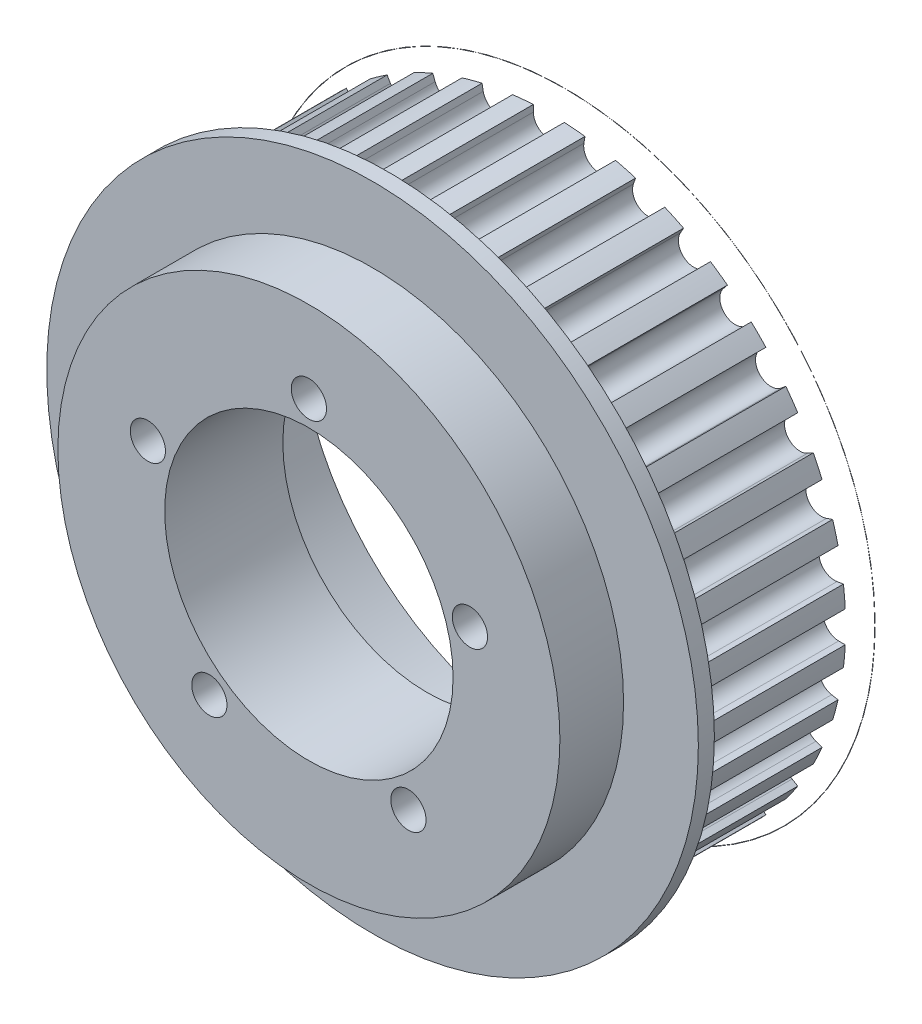
from build123d import *

# Parameters (mm, degrees)
CUT_EXTRUDE1_START         = 1.905
CUT_EXTRUDE1_DEPTH         = 16.51
CIRPATTERN1_COUNT          = 36
SKETCH4_W                  = 12.7
SKETCH4_H                  = 22.86
SKETCH4_W_2                = 2.415
SKETCH4_H_2                = 30.23
CUT_EXTRUDE2_DEPTH         = 1.51
SKETCH6_R                  = 23.5
CUT_EXTRUDE3_DEPTH         = 11.4
SKETCH7_R                  = 13.5
CUT_EXTRUDE4_DEPTH         = 3.6
SKETCH8_R                  = 23.5
SKETCH8_R_2                = 13.5
BOSS_EXTRUDE1_DEPTH        = 7.46
SKETCH10_W                 = 1.65
SKETCH10_H                 = 23.97
M4_TAPPED_HOLE1_AT_2_COUNT = 2
M4_TAPPED_HOLE1_AT_2_PITCH = 18.632792498
M4_TAPPED_HOLE1_AT_3_COUNT = 2
M4_TAPPED_HOLE1_AT_3_PITCH = 30.148491567
M4_TAPPED_HOLE1_AT_4_COUNT = 2
M4_TAPPED_HOLE1_AT_4_PITCH = 30.148491567
M4_TAPPED_HOLE1_AT_5_COUNT = 2
M4_TAPPED_HOLE1_AT_5_PITCH = 18.632792498
SKETCH11_R                 = 30.5
SKETCH11_R_2               = 23.5
BOSS_EXTRUDE3_DEPTH        = 1.5


with BuildPart() as part:
    # Sketch2 → Revolve1 (revolve)
    with BuildSketch(Plane(origin=(0, 0, 0), x_dir=(0, 0, -1), z_dir=(1, 0, 0)), mode=Mode.PRIVATE) as revolve1_sk:
        with BuildLine():
            Line((-17.02, 6.75), (17.02, 6.75))
            Line((17.02, 6.75), (17.02, 30.23))
            Line((17.02, 30.23), (15.8125, 30.23))
            ThreePointArc((15.8125, 30.23), (14.953775664, 29.87144327), (14.605, 29.0087))
            Line((14.605, 29.0087), (14.605, 27.7874))
            Line((14.605, 27.7874), (-1.905, 27.7874))
            Line((-1.905, 27.7874), (-1.905, 29.0087))
            ThreePointArc((-1.905, 29.0087), (-2.257840529, 29.867424336), (-3.1125, 30.23))
            Line((-3.1125, 30.23), (-4.32, 30.23))
            Line((-4.32, 30.23), (-4.32, 22.86))
            Line((-4.32, 22.86), (-17.02, 22.86))
            Line((-17.02, 22.86), (-17.02, 6.75))
        make_face()
    revolve(revolve1_sk.sketch.rotate(Axis((0, 0, 17.02), (0, 0, -1)), 90), axis=Axis((0, 0, 17.02), (0, 0, -1)))

    # Sketch3 → Cut-Extrude1 (cut)
    with BuildSketch(Plane.XY.offset(CUT_EXTRUDE1_START)):
        with BuildLine():
            Line((-1.447918132, 27.137202459), (-1.45442745, 27.749310614))
            ThreePointArc((-1.45442745, 27.749310614), (0, 27.7874), (1.45442745, 27.749310614))
            Line((1.45442745, 27.749310614), (1.447918132, 27.137202459))
            ThreePointArc((1.447918132, 27.137202459), (0, 25.7046), (-1.447918132, 27.137202459))
        make_face()
    cut_extrude1 = extrude(amount=-CUT_EXTRUDE1_DEPTH, mode=Mode.SUBTRACT)

    # CirPattern1: Cut-Extrude1 ×36 about axis
    cirpattern1_axis = Axis((0, 0, 0), (0, 0, 1))
    for i in range(1, CIRPATTERN1_COUNT):
        add(cut_extrude1.rotate(cirpattern1_axis, i * 360 / CIRPATTERN1_COUNT), mode=Mode.SUBTRACT)

    # Sketch4 → Cut-Revolve2 (revolve, cut)
    with BuildSketch(Plane(origin=(0, 0, 0), x_dir=(0, 0, -1), z_dir=(1, 0, 0)), mode=Mode.PRIVATE) as cut_revolve2_sk:
        with Locations((-10.67, 11.43)):
            Rectangle(SKETCH4_W, SKETCH4_H)
        Polygon((-4.32, 0), (-1.905, 0), (-1.905, 30.23), (-4.32, 30.23), (-4.32, 22.86), align=None)
        with Locations((15.8125, 15.115)):
            Rectangle(SKETCH4_W_2, SKETCH4_H_2)
    revolve(cut_revolve2_sk.sketch.rotate(Axis((0, 0, 0), (0, 0, 1)), 180), axis=Axis((0, 0, 0), (0, 0, 1)), mode=Mode.SUBTRACT)


with BuildPart() as cut_revolve2_piece_1:
    # of the separate pieces the step leaves, piece 1, a body of its own (cut_revolve2_pieces)
    add(part.part.solids().sort_by_distance((6.75, 0, 1.905))[0])

    # Sketch5 → Cut-Extrude2 (cut)
    with BuildSketch(Plane(origin=(0, 0, -14.605), x_dir=(-1, 0, 0), z_dir=(0, 0, -1))):
        with BuildLine():
            Line((26.473499032, 6.138246756), (27.075177557, 6.250948649))
            ThreePointArc((27.075177557, 6.250948649), (26.840567305, 7.191908334), (26.573265901, 8.124108451))
            Line((26.573265901, 8.124108451), (25.995846067, 7.920871891))
            ThreePointArc((25.995846067, 7.920871891), (24.15442294, 8.791490976), (25.005411733, 10.642067858))
            Line((25.005411733, 10.642067858), (25.578378931, 10.857537936))
            ThreePointArc((25.578378931, 10.857537936), (25.183937002, 11.743462686), (24.758821654, 12.615084187))
            Line((24.758821654, 12.615084187), (24.225465783, 12.314667345))
            ThreePointArc((24.225465783, 12.314667345), (22.260836594, 12.8523), (22.777547651, 14.822535114))
            Line((22.777547651, 14.822535114), (23.304394204, 15.134226427))
            ThreePointArc((23.304394204, 15.134226427), (22.762105515, 15.938197867), (22.19209314, 16.722756974))
            Line((22.19209314, 16.722756974), (21.71900698, 16.334287864))
            ThreePointArc((21.71900698, 16.334287864), (19.690865993, 16.522598392), (19.857599311, 18.552627141))
            Line((19.857599311, 18.552627141), (20.322317252, 18.951069106))
            ThreePointArc((20.322317252, 18.951069106), (19.648658972, 19.648658972), (18.951069106, 20.322317252))
            Line((18.951069106, 20.322317252), (18.552627141, 19.857599311))
            ThreePointArc((18.552627141, 19.857599311), (16.522598392, 19.690865993), (16.334287864, 21.71900698))
            Line((16.334287864, 21.71900698), (16.722756974, 22.19209314))
            ThreePointArc((16.722756974, 22.19209314), (15.938197867, 22.762105515), (15.134226427, 23.304394204))
            Line((15.134226427, 23.304394204), (14.822535114, 22.777547651))
            ThreePointArc((14.822535114, 22.777547651), (12.8523, 22.260836594), (12.314667345, 24.225465783))
            Line((12.314667345, 24.225465783), (12.615084187, 24.758821654))
            ThreePointArc((12.615084187, 24.758821654), (11.743462686, 25.183937002), (10.857537936, 25.578378931))
            Line((10.857537936, 25.578378931), (10.642067858, 25.005411733))
            ThreePointArc((10.642067858, 25.005411733), (8.791490976, 24.15442294), (7.920871891, 25.995846067))
            Line((7.920871891, 25.995846067), (8.124108451, 26.573265901))
            ThreePointArc((8.124108451, 26.573265901), (7.191908334, 26.840567305), (6.250948649, 27.075177557))
            Line((6.250948649, 27.075177557), (6.138246756, 26.473499032))
            ThreePointArc((6.138246756, 26.473499032), (4.463556948, 25.314089368), (3.286404752, 26.976355722))
            Line((3.286404752, 26.976355722), (3.386285791, 27.58029491))
            ThreePointArc((3.386285791, 27.58029491), (2.421831486, 27.681660554), (1.45442745, 27.749310614))
            Line((1.45442745, 27.749310614), (1.447918132, 27.137202459))
            ThreePointArc((1.447918132, 27.137202459), (0, 25.7046), (-1.447918132, 27.137202459))
            Line((-1.447918132, 27.137202459), (-1.45442745, 27.749310614))
            ThreePointArc((-1.45442745, 27.749310614), (-2.421831486, 27.681660554), (-3.386285791, 27.58029491))
            Line((-3.386285791, 27.58029491), (-3.286404752, 26.976355722))
            ThreePointArc((-3.286404752, 26.976355722), (-4.463556948, 25.314089368), (-6.138246756, 26.473499032))
            Line((-6.138246756, 26.473499032), (-6.250948649, 27.075177557))
            ThreePointArc((-6.250948649, 27.075177557), (-7.191908334, 26.840567305), (-8.124108451, 26.573265901))
            Line((-8.124108451, 26.573265901), (-7.920871891, 25.995846067))
            ThreePointArc((-7.920871891, 25.995846067), (-8.791490976, 24.15442294), (-10.642067858, 25.005411733))
            Line((-10.642067858, 25.005411733), (-10.857537936, 25.578378931))
            ThreePointArc((-10.857537936, 25.578378931), (-11.743462686, 25.183937002), (-12.615084187, 24.758821654))
            Line((-12.615084187, 24.758821654), (-12.314667345, 24.225465783))
            ThreePointArc((-12.314667345, 24.225465783), (-12.8523, 22.260836594), (-14.822535114, 22.777547651))
            Line((-14.822535114, 22.777547651), (-15.134226427, 23.304394204))
            ThreePointArc((-15.134226427, 23.304394204), (-15.938197867, 22.762105515), (-16.722756974, 22.19209314))
            Line((-16.722756974, 22.19209314), (-16.334287864, 21.71900698))
            ThreePointArc((-16.334287864, 21.71900698), (-16.522598392, 19.690865993), (-18.552627141, 19.857599311))
            Line((-18.552627141, 19.857599311), (-18.951069106, 20.322317252))
            ThreePointArc((-18.951069106, 20.322317252), (-19.648658972, 19.648658972), (-20.322317252, 18.951069106))
            Line((-20.322317252, 18.951069106), (-19.857599311, 18.552627141))
            ThreePointArc((-19.857599311, 18.552627141), (-19.690865993, 16.522598392), (-21.71900698, 16.334287864))
            Line((-21.71900698, 16.334287864), (-22.19209314, 16.722756974))
            ThreePointArc((-22.19209314, 16.722756974), (-22.762105515, 15.938197867), (-23.304394204, 15.134226427))
            Line((-23.304394204, 15.134226427), (-22.777547651, 14.822535114))
            ThreePointArc((-22.777547651, 14.822535114), (-22.260836594, 12.8523), (-24.225465783, 12.314667345))
            Line((-24.225465783, 12.314667345), (-24.758821654, 12.615084187))
            ThreePointArc((-24.758821654, 12.615084187), (-25.183937002, 11.743462686), (-25.578378931, 10.857537936))
            Line((-25.578378931, 10.857537936), (-25.005411733, 10.642067858))
            ThreePointArc((-25.005411733, 10.642067858), (-24.15442294, 8.791490976), (-25.995846067, 7.920871891))
            Line((-25.995846067, 7.920871891), (-26.573265901, 8.124108451))
            ThreePointArc((-26.573265901, 8.124108451), (-26.840567305, 7.191908334), (-27.075177557, 6.250948649))
            Line((-27.075177557, 6.250948649), (-26.473499032, 6.138246756))
            ThreePointArc((-26.473499032, 6.138246756), (-25.314089368, 4.463556948), (-26.976355722, 3.286404752))
            Line((-26.976355722, 3.286404752), (-27.58029491, 3.386285791))
            ThreePointArc((-27.58029491, 3.386285791), (-27.681660554, 2.421831486), (-27.749310614, 1.45442745))
            Line((-27.749310614, 1.45442745), (-27.137202459, 1.447918132))
            ThreePointArc((-27.137202459, 1.447918132), (-25.7046, 0), (-27.137202459, -1.447918132))
            Line((-27.137202459, -1.447918132), (-27.749310614, -1.45442745))
            ThreePointArc((-27.749310614, -1.45442745), (-27.681660554, -2.421831486), (-27.58029491, -3.386285791))
            Line((-27.58029491, -3.386285791), (-26.976355722, -3.286404752))
            ThreePointArc((-26.976355722, -3.286404752), (-25.314089368, -4.463556948), (-26.473499032, -6.138246756))
            Line((-26.473499032, -6.138246756), (-27.075177557, -6.250948649))
            ThreePointArc((-27.075177557, -6.250948649), (-26.840567305, -7.191908334), (-26.573265901, -8.124108451))
            Line((-26.573265901, -8.124108451), (-25.995846067, -7.920871891))
            ThreePointArc((-25.995846067, -7.920871891), (-24.15442294, -8.791490976), (-25.005411733, -10.642067858))
            Line((-25.005411733, -10.642067858), (-25.578378931, -10.857537936))
            ThreePointArc((-25.578378931, -10.857537936), (-25.183937002, -11.743462686), (-24.758821654, -12.615084187))
            Line((-24.758821654, -12.615084187), (-24.225465783, -12.314667345))
            ThreePointArc((-24.225465783, -12.314667345), (-22.260836594, -12.8523), (-22.777547651, -14.822535114))
            Line((-22.777547651, -14.822535114), (-23.304394204, -15.134226427))
            ThreePointArc((-23.304394204, -15.134226427), (-22.762105515, -15.938197867), (-22.19209314, -16.722756974))
            Line((-22.19209314, -16.722756974), (-21.71900698, -16.334287864))
            ThreePointArc((-21.71900698, -16.334287864), (-19.690865993, -16.522598392), (-19.857599311, -18.552627141))
            Line((-19.857599311, -18.552627141), (-20.322317252, -18.951069106))
            ThreePointArc((-20.322317252, -18.951069106), (-19.648658972, -19.648658972), (-18.951069106, -20.322317252))
            Line((-18.951069106, -20.322317252), (-18.552627141, -19.857599311))
            ThreePointArc((-18.552627141, -19.857599311), (-16.522598392, -19.690865993), (-16.334287864, -21.71900698))
            Line((-16.334287864, -21.71900698), (-16.722756974, -22.19209314))
            ThreePointArc((-16.722756974, -22.19209314), (-15.938197867, -22.762105515), (-15.134226427, -23.304394204))
            Line((-15.134226427, -23.304394204), (-14.822535114, -22.777547651))
            ThreePointArc((-14.822535114, -22.777547651), (-12.8523, -22.260836594), (-12.314667345, -24.225465783))
            Line((-12.314667345, -24.225465783), (-12.615084187, -24.758821654))
            ThreePointArc((-12.615084187, -24.758821654), (-11.743462686, -25.183937002), (-10.857537936, -25.578378931))
            Line((-10.857537936, -25.578378931), (-10.642067858, -25.005411733))
            ThreePointArc((-10.642067858, -25.005411733), (-8.791490976, -24.15442294), (-7.920871891, -25.995846067))
            Line((-7.920871891, -25.995846067), (-8.124108451, -26.573265901))
            ThreePointArc((-8.124108451, -26.573265901), (-7.191908334, -26.840567305), (-6.250948649, -27.075177557))
            Line((-6.250948649, -27.075177557), (-6.138246756, -26.473499032))
            ThreePointArc((-6.138246756, -26.473499032), (-4.463556948, -25.314089368), (-3.286404752, -26.976355722))
            Line((-3.286404752, -26.976355722), (-3.386285791, -27.58029491))
            ThreePointArc((-3.386285791, -27.58029491), (-2.421831486, -27.681660554), (-1.45442745, -27.749310614))
            Line((-1.45442745, -27.749310614), (-1.447918132, -27.137202459))
            ThreePointArc((-1.447918132, -27.137202459), (0, -25.7046), (1.447918132, -27.137202459))
            Line((1.447918132, -27.137202459), (1.45442745, -27.749310614))
            ThreePointArc((1.45442745, -27.749310614), (2.421831486, -27.681660554), (3.386285791, -27.58029491))
            Line((3.386285791, -27.58029491), (3.286404752, -26.976355722))
            ThreePointArc((3.286404752, -26.976355722), (4.463556948, -25.314089368), (6.138246756, -26.473499032))
            Line((6.138246756, -26.473499032), (6.250948649, -27.075177557))
            ThreePointArc((6.250948649, -27.075177557), (7.191908334, -26.840567305), (8.124108451, -26.573265901))
            Line((8.124108451, -26.573265901), (7.920871891, -25.995846067))
            ThreePointArc((7.920871891, -25.995846067), (8.791490976, -24.15442294), (10.642067858, -25.005411733))
            Line((10.642067858, -25.005411733), (10.857537936, -25.578378931))
            ThreePointArc((10.857537936, -25.578378931), (11.743462686, -25.183937002), (12.615084187, -24.758821654))
            Line((12.615084187, -24.758821654), (12.314667345, -24.225465783))
            ThreePointArc((12.314667345, -24.225465783), (12.8523, -22.260836594), (14.822535114, -22.777547651))
            Line((14.822535114, -22.777547651), (15.134226427, -23.304394204))
            ThreePointArc((15.134226427, -23.304394204), (15.938197867, -22.762105515), (16.722756974, -22.19209314))
            Line((16.722756974, -22.19209314), (16.334287864, -21.71900698))
            ThreePointArc((16.334287864, -21.71900698), (16.522598392, -19.690865993), (18.552627141, -19.857599311))
            Line((18.552627141, -19.857599311), (18.951069106, -20.322317252))
            ThreePointArc((18.951069106, -20.322317252), (19.648658972, -19.648658972), (20.322317252, -18.951069106))
            Line((20.322317252, -18.951069106), (19.857599311, -18.552627141))
            ThreePointArc((19.857599311, -18.552627141), (19.690865993, -16.522598392), (21.71900698, -16.334287864))
            Line((21.71900698, -16.334287864), (22.19209314, -16.722756974))
            ThreePointArc((22.19209314, -16.722756974), (22.762105515, -15.938197867), (23.304394204, -15.134226427))
            Line((23.304394204, -15.134226427), (22.777547651, -14.822535114))
            ThreePointArc((22.777547651, -14.822535114), (22.260836594, -12.8523), (24.225465783, -12.314667345))
            Line((24.225465783, -12.314667345), (24.758821654, -12.615084187))
            ThreePointArc((24.758821654, -12.615084187), (25.183937002, -11.743462686), (25.578378931, -10.857537936))
            Line((25.578378931, -10.857537936), (25.005411733, -10.642067858))
            ThreePointArc((25.005411733, -10.642067858), (24.15442294, -8.791490976), (25.995846067, -7.920871891))
            Line((25.995846067, -7.920871891), (26.573265901, -8.124108451))
            ThreePointArc((26.573265901, -8.124108451), (26.840567305, -7.191908334), (27.075177557, -6.250948649))
            Line((27.075177557, -6.250948649), (26.473499032, -6.138246756))
            ThreePointArc((26.473499032, -6.138246756), (25.314089368, -4.463556948), (26.976355722, -3.286404752))
            Line((26.976355722, -3.286404752), (27.58029491, -3.386285791))
            ThreePointArc((27.58029491, -3.386285791), (27.681660554, -2.421831486), (27.749310614, -1.45442745))
            Line((27.749310614, -1.45442745), (27.137202459, -1.447918132))
            ThreePointArc((27.137202459, -1.447918132), (25.7046, 0), (27.137202459, 1.447918132))
            Line((27.137202459, 1.447918132), (27.749310614, 1.45442745))
            ThreePointArc((27.749310614, 1.45442745), (27.681660554, 2.421831486), (27.58029491, 3.386285791))
            Line((27.58029491, 3.386285791), (26.976355722, 3.286404752))
            ThreePointArc((26.976355722, 3.286404752), (25.314089368, 4.463556948), (26.473499032, 6.138246756))
        make_face()
    extrude(amount=-CUT_EXTRUDE2_DEPTH, mode=Mode.SUBTRACT)

    # Sketch6 → Cut-Extrude3 (cut)
    with BuildSketch(Plane(origin=(0, 0, -13.095), x_dir=(-1, 0, 0), z_dir=(0, 0, -1))):
        with Locations(Location((0, 0, 0), (0, 0, 90))):
            Circle(SKETCH6_R)
    extrude(amount=-CUT_EXTRUDE3_DEPTH, mode=Mode.SUBTRACT)

    # Sketch7 → Cut-Extrude4 (cut)
    with BuildSketch(Plane.XY.offset(1.905)):
        Circle(SKETCH7_R)
    extrude(amount=-CUT_EXTRUDE4_DEPTH, mode=Mode.SUBTRACT)

    # Sketch8 → Boss-Extrude1 (add)
    with BuildSketch(Plane.XY.offset(1.905)):
        with Locations(Location((0, 0, 0), (0, 0, 90))):
            Circle(SKETCH8_R)
        Circle(SKETCH8_R_2, mode=Mode.SUBTRACT)
    extrude(amount=BOSS_EXTRUDE1_DEPTH)

    # Sketch10 → M4 Tapped Hole1 (revolve, cut)
    with BuildSketch(Plane(origin=(0, 15.85, 9.365), x_dir=(0, -1, 0), z_dir=(1, 0, 0))):
        with Locations((0.825, 11.985)):
            Rectangle(SKETCH10_W, SKETCH10_H)
    m4_tapped_hole1 = revolve(axis=Axis((0, 15.85, 15.715), (0, 0, -1)), mode=Mode.SUBTRACT)

    # M4 Tapped Hole1 at 2: M4 Tapped Hole1 ×2
    with Locations(*[Vector(0.8090169943749476, -0.5877852522924731, 0) * (i * M4_TAPPED_HOLE1_AT_2_PITCH) for i in range(1, M4_TAPPED_HOLE1_AT_2_COUNT)]):
        add(m4_tapped_hole1, mode=Mode.SUBTRACT)

    # M4 Tapped Hole1 at 3: M4 Tapped Hole1 ×2
    with Locations(*[Vector(0.3090169943749475, -0.9510565162951535, 0) * (i * M4_TAPPED_HOLE1_AT_3_PITCH) for i in range(1, M4_TAPPED_HOLE1_AT_3_COUNT)]):
        add(m4_tapped_hole1, mode=Mode.SUBTRACT)

    # M4 Tapped Hole1 at 4: M4 Tapped Hole1 ×2
    with Locations(*[Vector(-0.30901699437494745, -0.9510565162951536, 0) * (i * M4_TAPPED_HOLE1_AT_4_PITCH) for i in range(1, M4_TAPPED_HOLE1_AT_4_COUNT)]):
        add(m4_tapped_hole1, mode=Mode.SUBTRACT)

    # M4 Tapped Hole1 at 5: M4 Tapped Hole1 ×2
    with Locations(*[Vector(-0.8090169943749476, -0.587785252292473, 0) * (i * M4_TAPPED_HOLE1_AT_5_PITCH) for i in range(1, M4_TAPPED_HOLE1_AT_5_COUNT)]):
        add(m4_tapped_hole1, mode=Mode.SUBTRACT)

    # Sketch11 → Boss-Extrude3 (add)
    with BuildSketch(Plane.XY.offset(1.905)):
        Circle(SKETCH11_R)
        with Locations(Location((0, 0, 0), (0, 0, 90))):
            Circle(SKETCH11_R_2, mode=Mode.SUBTRACT)
    extrude(amount=BOSS_EXTRUDE3_DEPTH)


with BuildPart() as cut_revolve2_piece_2:
    # of the separate pieces the step leaves, piece 2, a body of its own (cut_revolve2_pieces)
    add(part.part.solids().sort_by_distance((29.036144068, 0, -14.605))[0])


solid = Compound([cut_revolve2_piece_1.part, cut_revolve2_piece_2.part])
